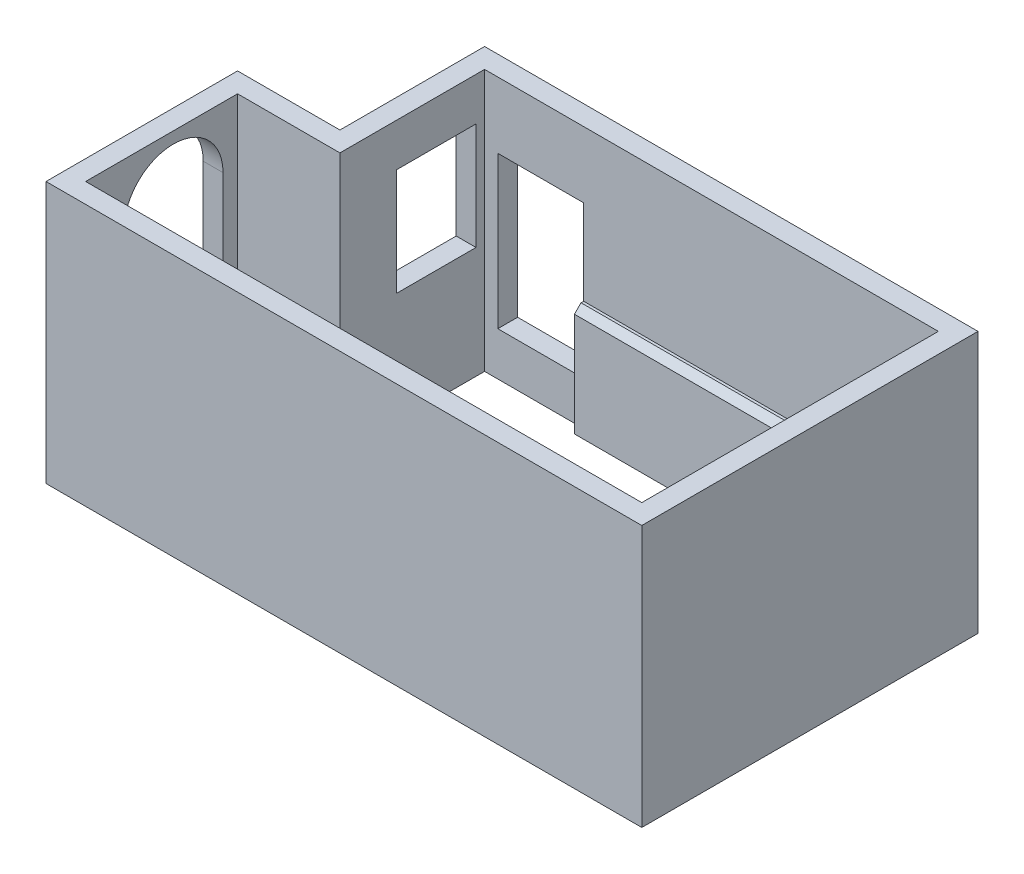
from build123d import *

# Parameters (mm, degrees)
SKETCH_1_W             = 6870
SKETCH_1_H             = 300
EXTRUDE_1381_DEPTH     = 3960
SKETCH_3_W             = 1300
SKETCH_3_H             = 2300
CUT_EXTRUDE_1685_DEPTH = 300
SKETCH_4_W             = 5370
SKETCH_4_H             = 1670
EXTRUDE_1932_DEPTH     = 140
FILLET_START           = -84.347935733
FILLET_1_OUTLINE_W     = 5370
FILLET_1_OUTLINE_H     = 141.421356237
FILLET_1_DEPTH         = 71.347935733
SKETCH_5_W             = 1200
SKETCH_5_H             = 1620
CUT_EXTRUDE_2305_DEPTH = 300
CUT_EXTRUDE_2865_DEPTH = 300


with BuildPart() as part:
    # Эскиз1 → Extrude 1381 (new body)
    with BuildSketch(Plane(origin=(0, 0, 0), x_dir=(1, 0, 0), z_dir=(0, 1, 0))):
        Polygon((8076.35402749, -2660.714005328), (7776.35402749, -2660.714005328), (7776.35402749, 1829.285994672), (7776.35402749, 2129.285994672), (8076.35402749, 2129.285994672), align=None)
        with Locations((4341.35402749, 1979.285994672)):
            Rectangle(SKETCH_1_W, SKETCH_1_H)
        Polygon((-643.64597251, -2960.714005328), (-643.64597251, -2660.714005328), (7776.35402749, -2660.714005328), (8076.35402749, -2660.714005328), (8076.35402749, -2960.714005328), align=None)
        Polygon((-943.64597251, -360.714005328), (-643.64597251, -360.714005328), (-643.64597251, -2660.714005328), (-643.64597251, -2960.714005328), (-943.64597251, -2960.714005328), align=None)
        Polygon((-943.64597251, -60.714005328), (606.35402749, -60.714005328), (606.35402749, 2129.285994672), (906.35402749, 2129.285994672), (906.35402749, 1829.285994672), (906.35402749, -360.714005328), (-643.64597251, -360.714005328), (-943.64597251, -360.714005328), align=None)
    extrude(amount=EXTRUDE_1381_DEPTH)

    # Эскиз3 → Cut-Extrude 1685 (cut)
    with BuildSketch(Plane.XY.offset(-1829.285994672)):
        with Locations((1756.35402749, 1810)):
            Rectangle(SKETCH_3_W, SKETCH_3_H)
    extrude(amount=-CUT_EXTRUDE_1685_DEPTH, mode=Mode.SUBTRACT)

    # Эскиз4 → Extrude 1932 (add)
    with BuildSketch(Plane.XY.offset(-1829.285994672)):
        with Locations((5091.35402749, 835)):
            Rectangle(SKETCH_4_W, SKETCH_4_H)
    extrude(amount=EXTRUDE_1932_DEPTH)

    # Фаска1: read off the stored shape, not the designer's step
    # Фаска1 outline → Фаска1 (cut)
    with BuildSketch(Plane(origin=(0, 0, 0), x_dir=(1, 0, 0), z_dir=(0, 0.7071067811865476, 0.7071067811865476)).offset(FILLET_START)):
        with Locations((5091.35402749, 2375.373906778)):
            Rectangle(FILLET_1_OUTLINE_W, FILLET_1_OUTLINE_H)
    extrude(amount=FILLET_1_DEPTH, mode=Mode.SUBTRACT)

    # Эскиз5 → Cut-Extrude 2305 (cut)
    with BuildSketch(Plane(origin=(906.35402749, 0, 0), x_dir=(0, 0, -1), z_dir=(1, 0, 0))):
        with Locations((1099.285994672, 2500)):
            Rectangle(SKETCH_5_W, SKETCH_5_H)
    extrude(amount=-CUT_EXTRUDE_2305_DEPTH, mode=Mode.SUBTRACT)

    # Эскиз6 → Cut-Extrude 2865 (cut)
    with BuildSketch(Plane(origin=(-643.64597251, 0, 0), x_dir=(0, 0, -1), z_dir=(1, 0, 0))):
        with BuildLine():
            ThreePointArc((-1331.576330709, 3787.212133652), (-1880.20408957, 3548.991802146), (-2080.714005328, 2985.48748289))
            Line((-2080.714005328, 2985.48748289), (-2080.714005328, 1687.212133652))
            Line((-2080.714005328, 1687.212133652), (-1330.714005328, 1687.212133652))
            Line((-1330.714005328, 1687.212133652), (-1331.576330709, 3787.212133652))
        make_face()
        with BuildLine():
            ThreePointArc((-582.43865609, 3087.212133652), (-818.934336835, 3584.977567133), (-1331.576330709, 3787.212133652))
            Line((-1331.576330709, 3787.212133652), (-1330.714005328, 1687.212133652))
            Line((-1330.714005328, 1687.212133652), (-580.714005328, 1687.212133652))
            Line((-580.714005328, 1687.212133652), (-580.714005328, 3036.349808271))
            ThreePointArc((-580.714005328, 3036.349808271), (-581.145291881, 3061.79558672), (-582.43865609, 3087.212133652))
        make_face()
    extrude(amount=-CUT_EXTRUDE_2865_DEPTH, mode=Mode.SUBTRACT)


solid = part.part
